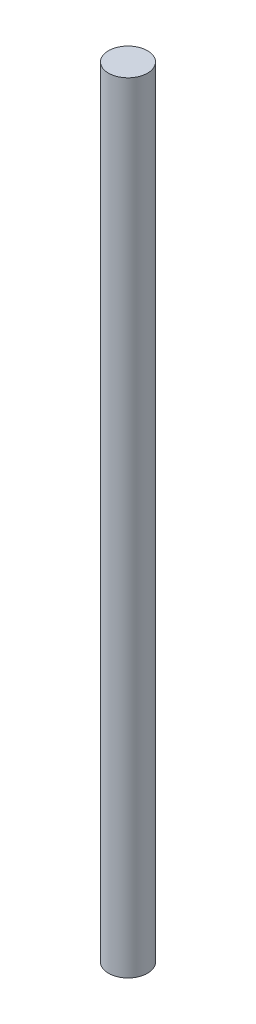
from build123d import *

# Parameters (mm, degrees)
SKETCH1_R           = 0.8
BOSS_EXTRUDE1_DEPTH = 32


with BuildPart() as part:
    # Sketch1 → Boss-Extrude1 (new body)
    with BuildSketch(Plane(origin=(0, 0, 0), x_dir=(1, 0, 0), z_dir=(0, 1, 0))):
        Circle(SKETCH1_R)
    extrude(amount=BOSS_EXTRUDE1_DEPTH)


solid = part.part
